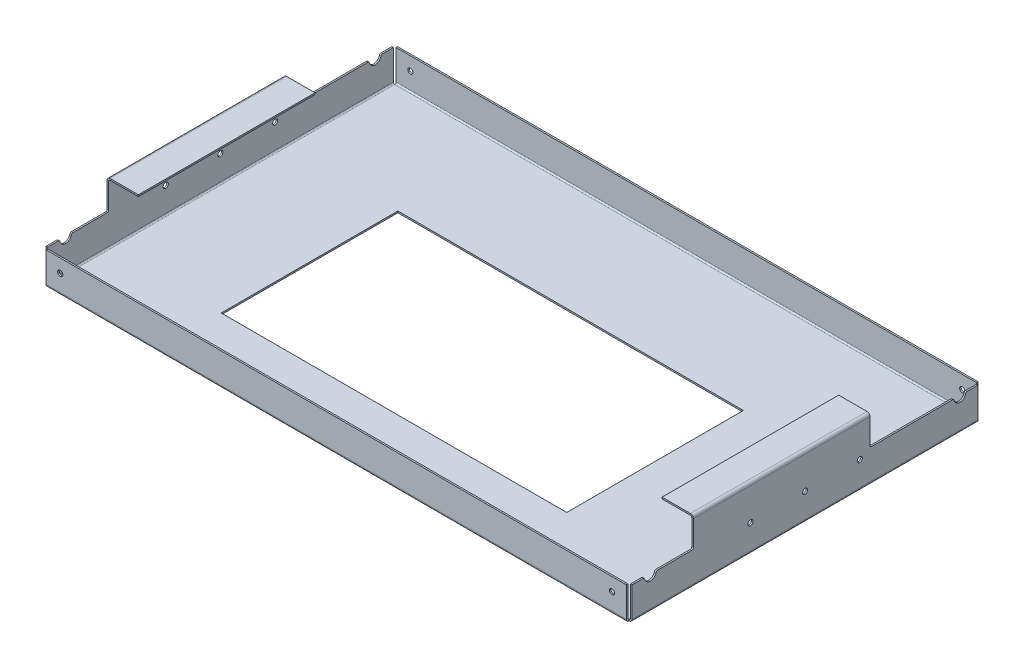
from build123d import *

# Parameters (mm, degrees)
SKETCH_1_W                         = 750
SKETCH_1_H                         = 2
SM_BASE_FLANGE_1_DEPTH             = 450
SM_EDGE_FLANGE_1_STRIP_W           = 11.6
SM_EDGE_FLANGE_1_STRIP_H           = 2
SM_EDGE_FLANGE_1_STRIP_CUT_DEPTH   = 750
SM_EDGE_FLANGE_1_STRIP_2_W         = 11.6
SM_EDGE_FLANGE_1_STRIP_2_H         = 2
SM_EDGE_FLANGE_1_STRIP_CUT_2_DEPTH = 750
SM_EDGE_FLANGE_1_DEPTH             = 750
SM_EDGE_FLANGE_1_BEND_DEPTH        = 750
SM_EDGE_FLANGE_2_STRIP_W           = 11.6
SM_EDGE_FLANGE_2_STRIP_H           = 2
SM_EDGE_FLANGE_2_STRIP_CUT_DEPTH   = 442.4
SM_EDGE_FLANGE_2_STRIP_2_W         = 11.6
SM_EDGE_FLANGE_2_STRIP_2_H         = 2
SM_EDGE_FLANGE_2_STRIP_CUT_2_DEPTH = 442.4
SM_EDGE_FLANGE_2_DEPTH             = 442.4
SM_EDGE_FLANGE_2_BEND_DEPTH        = 442.4
CUT_EXTRUDE_1_REACH                = 880.114
SKETCH_19_W                        = 3.8
SKETCH_19_H                        = 42
SKETCH_20_W                        = 3.8
SKETCH_20_H                        = 42
CUT_EXTRUDE_2_DEPTH                = 3.8
SKETCH_21_W                        = 442
SKETCH_21_H                        = 226
CUT_EXTRUDE_3_DEPTH                = 10
SM_EDGE_FLANGE_3_STRIP_W           = 11.6
SM_EDGE_FLANGE_3_STRIP_H           = 2
SM_EDGE_FLANGE_3_STRIP_CUT_DEPTH   = 442.4
SM_EDGE_FLANGE_3_STRIP_2_W         = 11.6
SM_EDGE_FLANGE_3_STRIP_2_H         = 2
SM_EDGE_FLANGE_3_STRIP_CUT_2_DEPTH = 442.4
SM_EDGE_FLANGE_3_DEPTH             = 442.4
SM_EDGE_FLANGE_3_BEND_DEPTH        = 442.4
CUT_EXTRUDE_4_DEPTH                = 879.11388783
HOLE_WIZARD_M61_D                  = 6.6
HOLE_WIZARD_M62_D                  = 6.6


# Sheet-metal steps are written as plain solids
with BuildPart() as part:
    # Sketch 1 → Базовая кромка1 (new body)
    with BuildSketch(Plane.XY):
        with Locations((375, -1)):
            Rectangle(SKETCH_1_W, SKETCH_1_H)
    extrude(amount=SM_BASE_FLANGE_1_DEPTH)

    # Ребро-кромка1 strip (across the edge) → Ребро-кромка1 strip cut (cut)
    with BuildSketch(Plane(origin=(0, 0, 450), x_dir=(0, 0, -1), z_dir=(1, 0, 0))):
        with Locations((-2, -1)):
            Rectangle(SM_EDGE_FLANGE_1_STRIP_W, SM_EDGE_FLANGE_1_STRIP_H)
    extrude(amount=SM_EDGE_FLANGE_1_STRIP_CUT_DEPTH, mode=Mode.SUBTRACT)

    # Ребро-кромка1 strip 2 (across the edge) → Ребро-кромка1 strip cut 2 (cut)
    with BuildSketch(Plane.ZY.offset(-750)):
        with Locations((-2, -1)):
            Rectangle(SM_EDGE_FLANGE_1_STRIP_2_W, SM_EDGE_FLANGE_1_STRIP_2_H)
    extrude(amount=SM_EDGE_FLANGE_1_STRIP_CUT_2_DEPTH, mode=Mode.SUBTRACT)

    # Ребро-кромка1 section (across the edge) → Ребро-кромка1 (add)
    with BuildSketch(Plane(origin=(0, 0, 450), x_dir=(0, 0, -1), z_dir=(1, 0, 0))):
        with BuildLine():
            Line((0, 1.8), (0, 40))
            Line((0, 40), (2, 40))
            Line((2, 40), (2, 1.8))
            ThreePointArc((2, 1.8), (2.527207794, 0.527207794), (3.8, 0))
            Line((3.8, 0), (3.8, -2))
            ThreePointArc((3.8, -2), (1.112994231, -0.887005769), (0, 1.8))
        make_face()
    extrude(amount=SM_EDGE_FLANGE_1_DEPTH)

    # Ребро-кромка1 section 2 (across the edge) → Ребро-кромка1 bend (add)
    with BuildSketch(Plane.ZY.offset(-750)):
        with BuildLine():
            Line((0, 1.8), (0, 40))
            Line((0, 40), (2, 40))
            Line((2, 40), (2, 1.8))
            ThreePointArc((2, 1.8), (2.527207794, 0.527207794), (3.8, 0))
            Line((3.8, 0), (3.8, -2))
            ThreePointArc((3.8, -2), (1.112994231, -0.887005769), (0, 1.8))
        make_face()
    extrude(amount=SM_EDGE_FLANGE_1_BEND_DEPTH)

    # Ребро-кромка2 strip (across the edge) → Ребро-кромка2 strip cut (cut)
    with BuildSketch(Plane.XY.offset(3.8)):
        with Locations((-2, -1)):
            Rectangle(SM_EDGE_FLANGE_2_STRIP_W, SM_EDGE_FLANGE_2_STRIP_H)
    extrude(amount=SM_EDGE_FLANGE_2_STRIP_CUT_DEPTH, mode=Mode.SUBTRACT)

    # Ребро-кромка2 strip 2 (across the edge) → Ребро-кромка2 strip cut 2 (cut)
    with BuildSketch(Plane(origin=(750, 0, 446.2), x_dir=(-1, 0, 0), z_dir=(0, 0, -1))):
        with Locations((-2, -1)):
            Rectangle(SM_EDGE_FLANGE_2_STRIP_2_W, SM_EDGE_FLANGE_2_STRIP_2_H)
    extrude(amount=SM_EDGE_FLANGE_2_STRIP_CUT_2_DEPTH, mode=Mode.SUBTRACT)

    # Ребро-кромка2 section (across the edge) → Ребро-кромка2 (add)
    with BuildSketch(Plane.XY.offset(3.8)):
        with BuildLine():
            Line((0, 1.8), (0, 78))
            Line((0, 78), (2, 78))
            Line((2, 78), (2, 1.8))
            ThreePointArc((2, 1.8), (2.527207794, 0.527207794), (3.8, 0))
            Line((3.8, 0), (3.8, -2))
            ThreePointArc((3.8, -2), (1.112994231, -0.887005769), (0, 1.8))
        make_face()
    extrude(amount=SM_EDGE_FLANGE_2_DEPTH)

    # Ребро-кромка2 section 2 (across the edge) → Ребро-кромка2 bend (add)
    with BuildSketch(Plane(origin=(750, 0, 446.2), x_dir=(-1, 0, 0), z_dir=(0, 0, -1))):
        with BuildLine():
            Line((0, 1.8), (0, 78))
            Line((0, 78), (2, 78))
            Line((2, 78), (2, 1.8))
            ThreePointArc((2, 1.8), (2.527207794, 0.527207794), (3.8, 0))
            Line((3.8, 0), (3.8, -2))
            ThreePointArc((3.8, -2), (1.112994231, -0.887005769), (0, 1.8))
        make_face()
    extrude(amount=SM_EDGE_FLANGE_2_BEND_DEPTH)

    # Вырез-Вытянуть1: up to this face of the body (flat: up to its plane)
    cut_extrude_1_end = Plane(part.part.faces().sort_by_distance((748.992300856, 38.893795601, 446.2))[0])
    # Эскиз19 → Вырез-Вытянуть1 (cut, up to the picked face)
    with BuildSketch(Plane.XY.offset(450), mode=Mode.PRIVATE) as cut_extrude_1_sk1:
        with Locations((1.9, 19)):
            Rectangle(SKETCH_19_W, SKETCH_19_H)
    cut_extrude_1_tool1 = split(extrude(cut_extrude_1_sk1.sketch, amount=-CUT_EXTRUDE_1_REACH, mode=Mode.PRIVATE), bisect_by=cut_extrude_1_end, keep=Keep.BOTH, mode=Mode.PRIVATE)
    # Эскиз19 → Вырез-Вытянуть1 (cut, up to the picked face)
    with BuildSketch(Plane.XY.offset(450), mode=Mode.PRIVATE) as cut_extrude_1_sk2:
        with Locations((748.1, 19)):
            Rectangle(SKETCH_19_W, SKETCH_19_H)
    cut_extrude_1_tool2 = split(extrude(cut_extrude_1_sk2.sketch, amount=-CUT_EXTRUDE_1_REACH, mode=Mode.PRIVATE), bisect_by=cut_extrude_1_end, keep=Keep.BOTH, mode=Mode.PRIVATE)
    add(cut_extrude_1_tool1.solids().sort_by(Axis((1.9, 19, 450), (0, 0, -1)))[0], mode=Mode.SUBTRACT)
    add(cut_extrude_1_tool2.solids().sort_by(Axis((748.1, 19, 450), (0, 0, -1)))[0], mode=Mode.SUBTRACT)

    # Эскиз20 → Вырез-Вытянуть2 (cut)
    with BuildSketch(Plane(origin=(0, 0, 0), x_dir=(-1, 0, 0), z_dir=(0, 0, -1))):
        with Locations((-748.1, 19)):
            Rectangle(SKETCH_20_W, SKETCH_20_H)
        with Locations((-1.9, 19)):
            Rectangle(SKETCH_20_W, SKETCH_20_H)
    extrude(amount=-CUT_EXTRUDE_2_DEPTH, mode=Mode.SUBTRACT)

    # Эскиз21 → Вырез-Вытянуть3 (cut)
    with BuildSketch(Plane(origin=(0, 0, 0), x_dir=(1, 0, 0), z_dir=(0, 1, 0))):
        with Locations((367, -255)):
            Rectangle(SKETCH_21_W, SKETCH_21_H)
    extrude(amount=-CUT_EXTRUDE_3_DEPTH, mode=Mode.SUBTRACT)

    # Ребро-кромка3 strip (across the edge) → Ребро-кромка3 strip cut (cut)
    with BuildSketch(Plane(origin=(748, 78, 446.2), x_dir=(0, -1, 0), z_dir=(0, 0, -1))):
        with Locations((-2, -1)):
            Rectangle(SM_EDGE_FLANGE_3_STRIP_W, SM_EDGE_FLANGE_3_STRIP_H)
    extrude(amount=SM_EDGE_FLANGE_3_STRIP_CUT_DEPTH, mode=Mode.SUBTRACT)

    # Ребро-кромка3 strip 2 (across the edge) → Ребро-кромка3 strip cut 2 (cut)
    with BuildSketch(Plane(origin=(2, 78, 3.8), x_dir=(0, -1, 0), z_dir=(0, 0, 1))):
        with Locations((-2, -1)):
            Rectangle(SM_EDGE_FLANGE_3_STRIP_2_W, SM_EDGE_FLANGE_3_STRIP_2_H)
    extrude(amount=SM_EDGE_FLANGE_3_STRIP_CUT_2_DEPTH, mode=Mode.SUBTRACT)

    # Ребро-кромка3 section (across the edge) → Ребро-кромка3 (add)
    with BuildSketch(Plane(origin=(748, 78, 446.2), x_dir=(0, -1, 0), z_dir=(0, 0, -1))):
        with BuildLine():
            Line((0, 1.8), (0, 38))
            Line((0, 38), (2, 38))
            Line((2, 38), (2, 1.8))
            ThreePointArc((2, 1.8), (2.527207794, 0.527207794), (3.8, 0))
            Line((3.8, 0), (3.8, -2))
            ThreePointArc((3.8, -2), (1.112994231, -0.887005769), (0, 1.8))
        make_face()
    extrude(amount=SM_EDGE_FLANGE_3_DEPTH)

    # Ребро-кромка3 section 2 (across the edge) → Ребро-кромка3 bend (add)
    with BuildSketch(Plane(origin=(2, 78, 3.8), x_dir=(0, -1, 0), z_dir=(0, 0, 1))):
        with BuildLine():
            Line((0, 1.8), (0, 38))
            Line((0, 38), (2, 38))
            Line((2, 38), (2, 1.8))
            ThreePointArc((2, 1.8), (2.527207794, 0.527207794), (3.8, 0))
            Line((3.8, 0), (3.8, -2))
            ThreePointArc((3.8, -2), (1.112994231, -0.887005769), (0, 1.8))
        make_face()
    extrude(amount=SM_EDGE_FLANGE_3_BEND_DEPTH)

    # Эскиз28 → Вырез-Вытянуть4 (cut, through all)
    with BuildSketch(Plane(origin=(750, 0, 0), x_dir=(0, 0, -1), z_dir=(1, 0, 0))):
        with BuildLine():
            Line((-446.2, 78), (-368, 78))
            Line((-368, 78), (-368, 42))
            ThreePointArc((-368, 42), (-368.585786438, 40.585786438), (-370, 40))
            Line((-370, 40), (-413.712912189, 40))
            ThreePointArc((-413.712912189, 40), (-414.969473914, 39.55597321), (-415.668088571, 38.421052632))
            ThreePointArc((-415.668088571, 38.421052632), (-423, 32.5), (-430.331911429, 38.421052632))
            ThreePointArc((-430.331911429, 38.421052632), (-431.030526086, 39.55597321), (-432.287087811, 40))
            Line((-432.287087811, 40), (-446.2, 40))
            Line((-446.2, 40), (-446.2, 78))
        make_face()
        with BuildLine():
            Line((-3.8, 78), (-142, 78))
            Line((-142, 78), (-142, 42))
            ThreePointArc((-142, 42), (-141.414213562, 40.585786438), (-140, 40))
            Line((-140, 40), (-36.287087811, 40))
            ThreePointArc((-36.287087811, 40), (-35.030526086, 39.55597321), (-34.331911429, 38.421052632))
            ThreePointArc((-34.331911429, 38.421052632), (-27, 32.5), (-19.668088571, 38.421052632))
            ThreePointArc((-19.668088571, 38.421052632), (-18.969473914, 39.55597321), (-17.712912189, 40))
            Line((-17.712912189, 40), (-3.8, 40))
            Line((-3.8, 40), (-3.8, 78))
        make_face()
    extrude(amount=-CUT_EXTRUDE_4_DEPTH, mode=Mode.SUBTRACT)

    # Отверстие с зазором M61 (through all)
    with Locations(Plane(origin=(0, 0, 0), x_dir=(-1, 0, 0), z_dir=(0, 0, -1))):
        with Locations((-728, 23), (-22, 23)):
            Hole(HOLE_WIZARD_M61_D / 2)

    # Отверстие с зазором M62 (through all)
    with Locations(Plane(origin=(750, 0, 0), x_dir=(0, 0, -1), z_dir=(1, 0, 0))):
        with Locations((-295, 33), (-225, 33), (-155, 33)):
            Hole(HOLE_WIZARD_M62_D / 2)


solid = part.part
